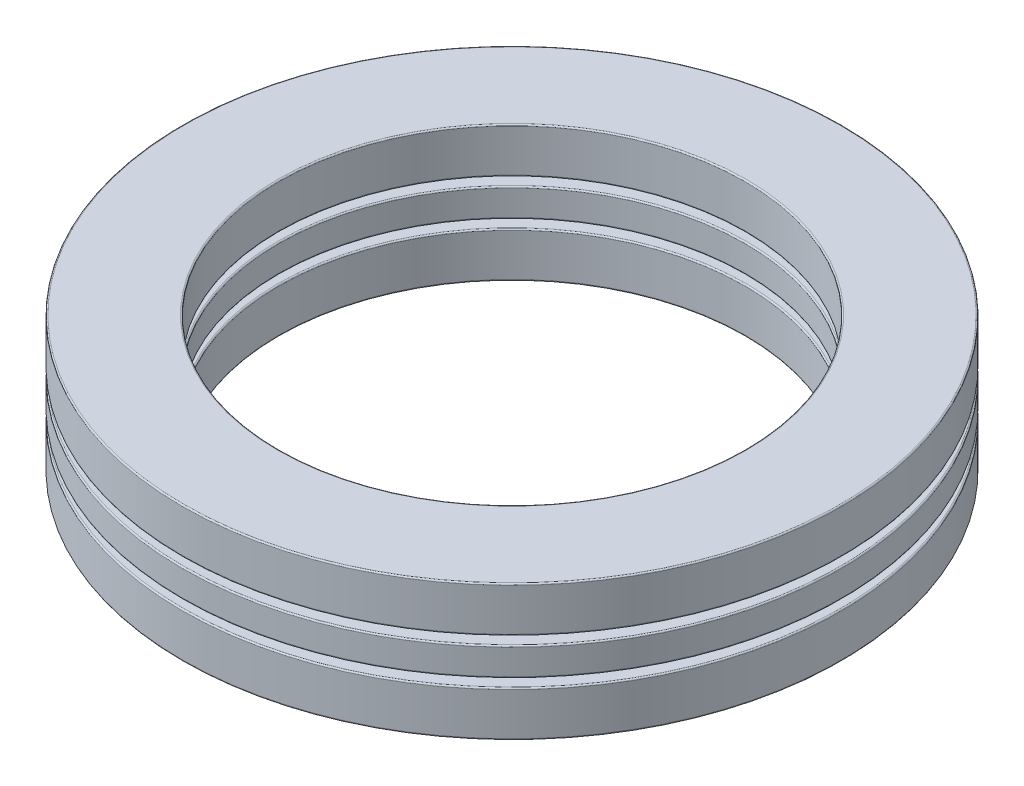
from build123d import *

# Parameters (mm, degrees)
SKETCH1_W         = 7.8994
SKETCH1_H         = 2.312458334
CIRPATTERN1_COUNT = 11
CIRPATTERN1_ANGLE = 327.272727273
CIRPATTERN2_COUNT = 11
SKETCH4_W         = 7.8994
SKETCH4_H         = 3.699933333
FILLET1_R         = 0.110998
FILLET2_R         = 0.110998
FILLET3_R         = 0.110998


with BuildPart() as part:
    # Sketch1 → Revolve1 (revolve)
    with BuildSketch(Plane(origin=(0, 0, 0), x_dir=(0, 0, -1), z_dir=(1, 0, 0))):
        with Locations((-23.0378, 0)):
            Rectangle(SKETCH1_W, SKETCH1_H)
    revolve(axis=Axis((0, -5.5499, 0), (0, 1, 0)))

    # Sketch3 → Cut-Revolve1 (revolve, cut)
    with BuildSketch(Plane(origin=(0, 0, 0), x_dir=(0, 0, -1), z_dir=(1, 0, 0))):
        with BuildLine():
            Line((-23.0378, 1.849966667), (-23.0378, -1.849966667))
            ThreePointArc((-23.0378, -1.849966667), (-24.887766667, 0), (-23.0378, 1.849966667))
        make_face()
    cut_revolve1 = revolve(axis=Axis((0, 1.849966667, 23.0378), (0, -1, 0)), mode=Mode.SUBTRACT)

    # CirPattern2: Cut-Revolve1 ×11 about axis
    cirpattern2_axis = Axis((0, 5.5499, 0), (0, -1, 0))
    for i in range(1, CIRPATTERN2_COUNT):
        add(cut_revolve1.rotate(cirpattern2_axis, i * 360 / CIRPATTERN2_COUNT), mode=Mode.SUBTRACT)

    # Fillet2
    fillet2_edges = [part.edges().sort_by_distance(p)[0] for p in [
        (0, -1.156229167, -19.0881),
        (0, 1.156229167, -19.0881),
        (0, -1.156229167, -26.9875),
        (0, 1.156229167, -26.9875),
    ]]
    fillet(fillet2_edges, radius=FILLET2_R)


with BuildPart() as body_2:
    # Sketch2 → Revolve2 (revolve)
    with BuildSketch(Plane(origin=(0, 0, 0), x_dir=(0, 0, -1), z_dir=(1, 0, 0))):
        with BuildLine():
            Line((-23.0378, 1.849966667), (-23.0378, -1.849966667))
            ThreePointArc((-23.0378, -1.849966667), (-24.887766667, 0), (-23.0378, 1.849966667))
        make_face()
    revolve(axis=Axis((0, 1.849966667, 23.0378), (0, -1, 0)))


with BuildPart() as cirpattern1_1:
    # CirPattern1: pattern copy
    add(body_2.part.rotate(Axis((0, 5.5499, 0), (0, -1, 0)), 1 * CIRPATTERN1_ANGLE / (CIRPATTERN1_COUNT - 1)))


with BuildPart() as cirpattern1_2:
    # CirPattern1: pattern copy
    add(body_2.part.rotate(Axis((0, 5.5499, 0), (0, -1, 0)), 2 * CIRPATTERN1_ANGLE / (CIRPATTERN1_COUNT - 1)))


with BuildPart() as cirpattern1_3:
    # CirPattern1: pattern copy
    add(body_2.part.rotate(Axis((0, 5.5499, 0), (0, -1, 0)), 3 * CIRPATTERN1_ANGLE / (CIRPATTERN1_COUNT - 1)))


with BuildPart() as cirpattern1_4:
    # CirPattern1: pattern copy
    add(body_2.part.rotate(Axis((0, 5.5499, 0), (0, -1, 0)), 4 * CIRPATTERN1_ANGLE / (CIRPATTERN1_COUNT - 1)))


with BuildPart() as cirpattern1_5:
    # CirPattern1: pattern copy
    add(body_2.part.rotate(Axis((0, 5.5499, 0), (0, -1, 0)), 5 * CIRPATTERN1_ANGLE / (CIRPATTERN1_COUNT - 1)))


with BuildPart() as cirpattern1_6:
    # CirPattern1: pattern copy
    add(body_2.part.rotate(Axis((0, 5.5499, 0), (0, -1, 0)), 6 * CIRPATTERN1_ANGLE / (CIRPATTERN1_COUNT - 1)))


with BuildPart() as cirpattern1_7:
    # CirPattern1: pattern copy
    add(body_2.part.rotate(Axis((0, 5.5499, 0), (0, -1, 0)), 7 * CIRPATTERN1_ANGLE / (CIRPATTERN1_COUNT - 1)))


with BuildPart() as cirpattern1_8:
    # CirPattern1: pattern copy
    add(body_2.part.rotate(Axis((0, 5.5499, 0), (0, -1, 0)), 8 * CIRPATTERN1_ANGLE / (CIRPATTERN1_COUNT - 1)))


with BuildPart() as cirpattern1_9:
    # CirPattern1: pattern copy
    add(body_2.part.rotate(Axis((0, 5.5499, 0), (0, -1, 0)), 9 * CIRPATTERN1_ANGLE / (CIRPATTERN1_COUNT - 1)))


with BuildPart() as cirpattern1_10:
    # CirPattern1: pattern copy
    add(body_2.part.rotate(Axis((0, 5.5499, 0), (0, -1, 0)), 10 * CIRPATTERN1_ANGLE / (CIRPATTERN1_COUNT - 1)))


with BuildPart() as body_13:
    # Sketch4 → Revolve3 (revolve)
    with BuildSketch(Plane(origin=(0, 0, 0), x_dir=(0, 0, -1), z_dir=(1, 0, 0))):
        with Locations((-23.0378, 3.699933334)):
            Rectangle(SKETCH4_W, SKETCH4_H)
        with Locations((-23.0378, -3.699933334)):
            Rectangle(SKETCH4_W, SKETCH4_H)
    revolve(axis=Axis((0, -5.5499, 0), (0, 1, 0)))

    # Fillet1
    fillet1_edges = [body_13.edges().sort_by_distance(p)[0] for p in [
        (0, 1.849966667, -19.0881),
        (0, 5.5499, -19.0881),
        (0, 1.849966667, -26.9875),
        (0, 5.5499, -26.9875),
    ]]
    fillet(fillet1_edges, radius=FILLET1_R)

    # Fillet3
    fillet3_edges = [body_13.edges().sort_by_distance(p)[0] for p in [
        (0, -5.5499, -19.0881),
        (0, -1.849966667, -19.0881),
        (0, -5.5499, -26.9875),
        (0, -1.849966667, -26.9875),
    ]]
    fillet(fillet3_edges, radius=FILLET3_R)


solid = Compound([part.part, body_2.part, cirpattern1_1.part, cirpattern1_2.part, cirpattern1_3.part, cirpattern1_4.part, cirpattern1_5.part, cirpattern1_6.part, cirpattern1_7.part, cirpattern1_8.part, cirpattern1_9.part, cirpattern1_10.part, body_13.part])
